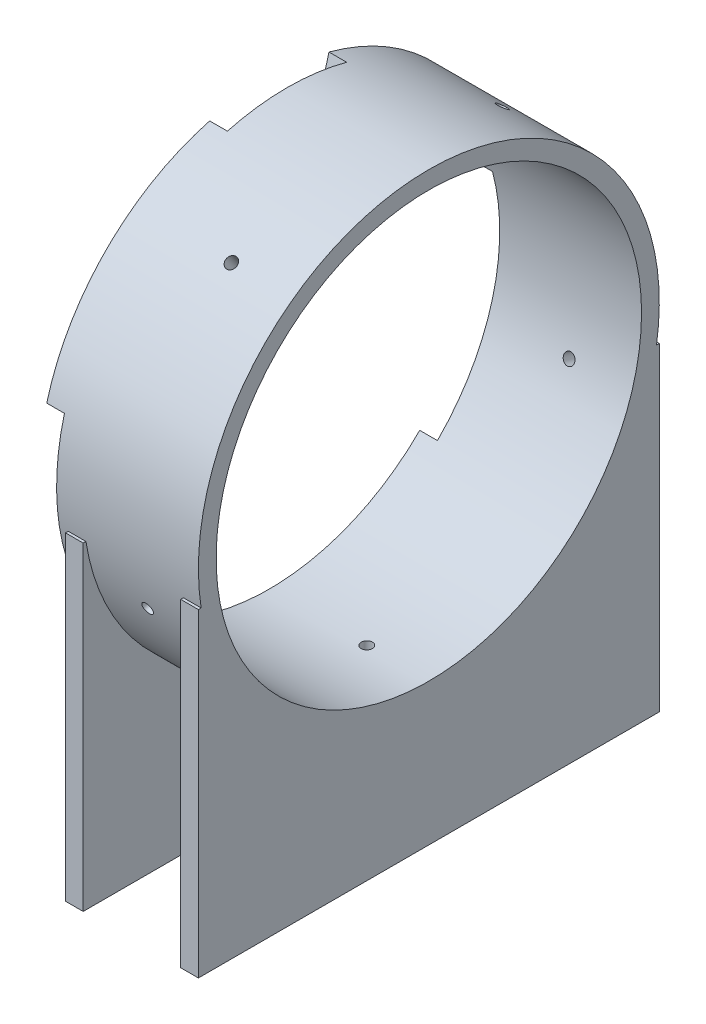
from build123d import *

# Parameters (mm, degrees)
SKETCH1_3_R                       = 260
SKETCH1_3_R_2                     = 240
BOSS_EXTRUDE1_DEPTH               = 150
BOSS_EXTRUDE2_DEPTH               = 20
BOSS_EXTRUDE3_START               = -20
BOSS_EXTRUDE3_DEPTH               = 20
BOSS_EXTRUDE4_START               = -30
SKETCH31_R                        = 260
SKETCH31_R_2                      = 240
BOSS_EXTRUDE4_DEPTH               = 30
CUT_EXTRUDE1_DEPTH                = 20
F_1_2_13_TAPPED_HOLE5_D           = 10.71626
F_1_2_13_TAPPED_HOLE5_DEPTH       = 45.9
F_1_2_13_TAPPED_HOLE5_CBORE_D     = 12.7
F_1_2_13_TAPPED_HOLE5_CBORE_DEPTH = 40
F_1_2_13_TAPPED_HOLE5_TIP         = 3.219489309
F_1_2_13_TAPPED_HOLE6_D           = 10.71626
F_1_2_13_TAPPED_HOLE6_DEPTH       = 45.9
F_1_2_13_TAPPED_HOLE6_CBORE_D     = 12.7
F_1_2_13_TAPPED_HOLE6_CBORE_DEPTH = 40
F_1_2_13_TAPPED_HOLE6_TIP         = 3.219489309


with BuildPart() as part:
    # Sketch1<3> → Boss-Extrude1 (new body)
    with BuildSketch(Plane(origin=(0, 0, 0), x_dir=(0, 0, -1), z_dir=(1, 0, 0))):
        Circle(SKETCH1_3_R)
        Circle(SKETCH1_3_R_2, mode=Mode.SUBTRACT)
    extrude(amount=BOSS_EXTRUDE1_DEPTH)

    # Sketch6 → Boss-Extrude2 (add)
    with BuildSketch(Plane(origin=(0, 0, 0), x_dir=(0, 0, -1), z_dir=(1, 0, 0))):
        with BuildLine():
            Line((-260, -40), (-260, -400))
            Line((-260, -400), (260, -400))
            Line((260, -400), (260, -40))
            Line((260, -40), (256.904651573, -40))
            ThreePointArc((256.904651573, -40), (0, -260), (-256.904651573, -40))
            Line((-256.904651573, -40), (-260, -40))
        make_face()
    extrude(amount=BOSS_EXTRUDE2_DEPTH)

    # Sketch11 → Boss-Extrude3 (add)
    with BuildSketch(Plane(origin=(150, 0, 0), x_dir=(0, 0, -1), z_dir=(1, 0, 0)).offset(BOSS_EXTRUDE3_START)):
        with BuildLine():
            Line((-260, -40), (-260, -400))
            Line((-260, -400), (260, -400))
            Line((260, -400), (260, -40))
            Line((260, -40), (256.904651573, -40))
            ThreePointArc((256.904651573, -40), (0, -260), (-256.904651573, -40))
            Line((-256.904651573, -40), (-260, -40))
        make_face()
    extrude(amount=BOSS_EXTRUDE3_DEPTH)

    # Sketch31 → Boss-Extrude4 (add)
    with BuildSketch(Plane(origin=(0, 0, 0), x_dir=(0, 0, -1), z_dir=(1, 0, 0)).offset(BOSS_EXTRUDE4_START)):
        with Locations(Location((0, 0, 0), (0, 0, 188.849883098))):
            Circle(SKETCH31_R)
        Circle(SKETCH31_R_2, mode=Mode.SUBTRACT)
    extrude(amount=BOSS_EXTRUDE4_DEPTH)

    # Sketch32 → Cut-Extrude1 (cut)
    with BuildSketch(Plane.ZY.offset(30)):
        with BuildLine():
            Line((62.116570825, 231.822198309), (67.292951727, 251.140714835))
            ThreePointArc((67.292951727, 251.140714835), (0, 260), (-67.292951727, 251.140714835))
            Line((-67.292951727, 251.140714835), (-62.116570825, 231.822198309))
            ThreePointArc((-62.116570825, 231.822198309), (0, 240), (62.116570825, 231.822198309))
        make_face()
        with BuildLine():
            Line((-231.822198309, 62.116570825), (-251.140714835, 67.292951727))
            ThreePointArc((-251.140714835, 67.292951727), (-251.140714835, -67.292951727), (-183.847763109, -183.847763109))
            Line((-183.847763109, -183.847763109), (-169.705627485, -169.705627485))
            ThreePointArc((-169.705627485, -169.705627485), (-231.822198309, -62.116570825), (-231.822198309, 62.116570825))
        make_face()
        with BuildLine():
            Line((231.822198309, 62.116570825), (251.140714835, 67.292951727))
            ThreePointArc((251.140714835, 67.292951727), (251.140714835, -67.292951727), (183.847763109, -183.847763109))
            Line((183.847763109, -183.847763109), (169.705627485, -169.705627485))
            ThreePointArc((169.705627485, -169.705627485), (231.822198309, -62.116570825), (231.822198309, 62.116570825))
        make_face()
    extrude(amount=-CUT_EXTRUDE1_DEPTH, mode=Mode.SUBTRACT)

    # 1/2-13 Tapped Hole4: read off the stored shape, not the designer's step
    # 1/2-13 Tapped Hole4: loft between two sections, ruled curve by curve
    f_1_2_13_tapped_hole4_from = [
        Edge.make_three_point_arc((79.999965478, 197.828529942, -135.881795772), (86.349965478, 194.096093813, -141.019053848), (79.999965478, 190.363657683, -146.156311923)),
        Edge.make_three_point_arc((79.999965478, 190.363657683, -146.156311923), (73.649965478, 194.096093813, -141.019053848), (79.999965478, 197.828529942, -135.881795772)),
    ]
    f_1_2_13_tapped_hole4_to = [
        Edge.make_three_point_arc((79.999965478, 214.076878188, -147.686910708), (86.349965478, 210.344442058, -152.824168784), (79.999965478, 206.612005929, -157.96142686)),
        Edge.make_three_point_arc((79.999965478, 206.612005929, -157.96142686), (73.649965478, 210.344442058, -152.824168784), (79.999965478, 214.076878188, -147.686910708)),
    ]
    f_1_2_13_tapped_hole4 = Solid(Shell([*[Face.make_surface_from_curves(f_1_2_13_tapped_hole4_from[k], f_1_2_13_tapped_hole4_to[k]) for k in range(2)], Face(Wire(f_1_2_13_tapped_hole4_from)), Face(Wire(f_1_2_13_tapped_hole4_to))]))
    add(f_1_2_13_tapped_hole4, mode=Mode.SUBTRACT)

    # 1_2-13 Tapped Hole4 2: loft between two sections, ruled curve by curve
    f_1_2_13_tapped_hole4_2_from = [
        Edge.make_three_point_arc((80.002357219, -68.079944388, -230.141501806), (86.352357219, -74.119314866, -228.179741312), (80.002357219, -80.158685343, -226.217980818)),
        Edge.make_three_point_arc((80.002357219, -80.158685343, -226.217980818), (73.652357219, -74.119314866, -228.179741312), (80.002357219, -68.079944388, -230.141501806)),
    ]
    f_1_2_13_tapped_hole4_2_to = [
        Edge.make_three_point_arc((80.002357219, -74.284687699, -249.243091264), (86.352357219, -80.324058176, -247.28133077), (80.002357219, -86.363428654, -245.319570276)),
        Edge.make_three_point_arc((80.002357219, -86.363428654, -245.319570276), (73.652357219, -80.324058176, -247.28133077), (80.002357219, -74.284687699, -249.243091264)),
    ]
    f_1_2_13_tapped_hole4_2 = Solid(Shell([*[Face.make_surface_from_curves(f_1_2_13_tapped_hole4_2_from[k], f_1_2_13_tapped_hole4_2_to[k]) for k in range(2)], Face(Wire(f_1_2_13_tapped_hole4_2_from)), Face(Wire(f_1_2_13_tapped_hole4_2_to))]))
    add(f_1_2_13_tapped_hole4_2, mode=Mode.SUBTRACT)

    # 1_2-13 Tapped Hole4 3: loft between two sections, ruled curve by curve
    f_1_2_13_tapped_hole4_3_from = [
        Edge.make_three_point_arc((79.997098518, -239.915939461, -6.3507223), (86.347098518, -239.915958579, -0.0007223), (79.997098518, -239.915977696, 6.3492777)),
        Edge.make_three_point_arc((79.997098518, -239.915977696, 6.3492777), (73.647098518, -239.915958579, -0.0007223), (79.997098518, -239.915939461, -6.3507223)),
    ]
    f_1_2_13_tapped_hole4_3_to = [
        Edge.make_three_point_arc((79.997098518, -260.000001784, -6.350782766), (86.347098518, -260.000020902, -0.000782766), (79.997098518, -260.000040019, 6.349217234)),
        Edge.make_three_point_arc((79.997098518, -260.000040019, 6.349217234), (73.647098518, -260.000020902, -0.000782766), (79.997098518, -260.000001784, -6.350782766)),
    ]
    f_1_2_13_tapped_hole4_3 = Solid(Shell([*[Face.make_surface_from_curves(f_1_2_13_tapped_hole4_3_from[k], f_1_2_13_tapped_hole4_3_to[k]) for k in range(2)], Face(Wire(f_1_2_13_tapped_hole4_3_from)), Face(Wire(f_1_2_13_tapped_hole4_3_to))]))
    add(f_1_2_13_tapped_hole4_3, mode=Mode.SUBTRACT)

    # 1_2-13 Tapped Hole4 4: loft between two sections, ruled curve by curve
    f_1_2_13_tapped_hole4_4_from = [
        Edge.make_three_point_arc((80.000990585, -80.176506259, 226.211665317), (86.350990585, -74.137290346, 228.173901579), (80.000990585, -68.098074432, 230.13613784)),
        Edge.make_three_point_arc((80.000990585, -68.098074432, 230.13613784), (73.650990585, -74.137290346, 228.173901579), (80.000990585, -80.176506259, 226.211665317)),
    ]
    f_1_2_13_tapped_hole4_4_to = [
        Edge.make_three_point_arc((80.000990585, -86.38275435, 245.312765914), (86.350990585, -80.343538436, 247.275002176), (80.000990585, -74.304322522, 249.237238438)),
        Edge.make_three_point_arc((80.000990585, -74.304322522, 249.237238438), (73.650990585, -80.343538436, 247.275002176), (80.000990585, -86.38275435, 245.312765914)),
    ]
    f_1_2_13_tapped_hole4_4 = Solid(Shell([*[Face.make_surface_from_curves(f_1_2_13_tapped_hole4_4_from[k], f_1_2_13_tapped_hole4_4_to[k]) for k in range(2)], Face(Wire(f_1_2_13_tapped_hole4_4_from)), Face(Wire(f_1_2_13_tapped_hole4_4_to))]))
    add(f_1_2_13_tapped_hole4_4, mode=Mode.SUBTRACT)

    # 1_2-13 Tapped Hole4 5: loft between two sections, ruled curve by curve
    f_1_2_13_tapped_hole4_5_from = [
        Edge.make_three_point_arc((80.000134505, 190.363599964, 146.1563871), (86.350134505, 194.096038123, 141.019130498), (80.000134505, 197.828476281, 135.881873896)),
        Edge.make_three_point_arc((80.000134505, 197.828476281, 135.881873896), (73.650134505, 194.096038123, 141.019130498), (80.000134505, 190.363599964, 146.1563871)),
    ]
    f_1_2_13_tapped_hole4_5_to = [
        Edge.make_three_point_arc((80.000134505, 206.611943548, 157.961508453), (86.350134505, 210.344381707, 152.824251851), (80.000134505, 214.076819865, 147.686995249)),
        Edge.make_three_point_arc((80.000134505, 214.076819865, 147.686995249), (73.650134505, 210.344381707, 152.824251851), (80.000134505, 206.611943548, 157.961508453)),
    ]
    f_1_2_13_tapped_hole4_5 = Solid(Shell([*[Face.make_surface_from_curves(f_1_2_13_tapped_hole4_5_from[k], f_1_2_13_tapped_hole4_5_to[k]) for k in range(2)], Face(Wire(f_1_2_13_tapped_hole4_5_from)), Face(Wire(f_1_2_13_tapped_hole4_5_to))]))
    add(f_1_2_13_tapped_hole4_5, mode=Mode.SUBTRACT)

    # 1/2-13 Tapped Hole5
    with Locations(Plane(origin=(10, -400, -250), x_dir=(0, 0, -1), z_dir=(0, -1, 0))):
        with Locations((0, 0), (0, 130), (-500, 0), (-500, 130)):
            CounterBoreHole(F_1_2_13_TAPPED_HOLE5_D / 2, F_1_2_13_TAPPED_HOLE5_CBORE_D / 2, F_1_2_13_TAPPED_HOLE5_CBORE_DEPTH, depth=F_1_2_13_TAPPED_HOLE5_DEPTH)
            with Locations((0, 0, -(F_1_2_13_TAPPED_HOLE5_DEPTH + F_1_2_13_TAPPED_HOLE5_TIP / 2))):  # 118° drill point
                Cone(0, F_1_2_13_TAPPED_HOLE5_D / 2, F_1_2_13_TAPPED_HOLE5_TIP, mode=Mode.SUBTRACT)

    # 1/2-13 Tapped Hole6
    with Locations(Plane(origin=(-30, 175.072738393, -178.464383762), x_dir=(0, 0, -1), z_dir=(-1, 0, 0))):
        with Locations((0, 0), (-353.468611377, -3.458800407), (-178.464383762, 425.072738393)):
            CounterBoreHole(F_1_2_13_TAPPED_HOLE6_D / 2, F_1_2_13_TAPPED_HOLE6_CBORE_D / 2, F_1_2_13_TAPPED_HOLE6_CBORE_DEPTH, depth=F_1_2_13_TAPPED_HOLE6_DEPTH)
            with Locations((0, 0, -(F_1_2_13_TAPPED_HOLE6_DEPTH + F_1_2_13_TAPPED_HOLE6_TIP / 2))):  # 118° drill point
                Cone(0, F_1_2_13_TAPPED_HOLE6_D / 2, F_1_2_13_TAPPED_HOLE6_TIP, mode=Mode.SUBTRACT)


solid = part.part
